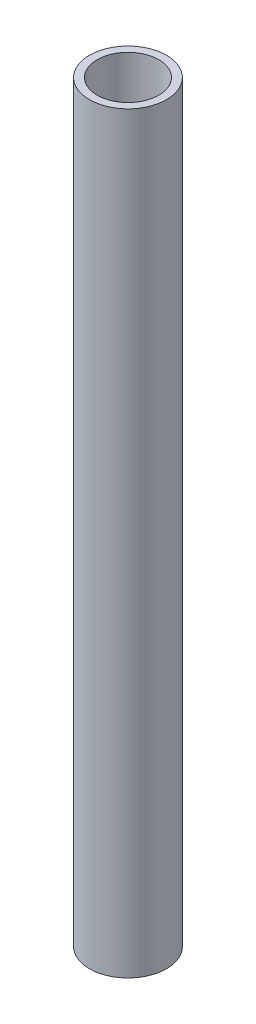
from build123d import *

# Parameters (mm, degrees)
SKETCH1_R           = 10
SKETCH1_R_2         = 8
BOSS_EXTRUDE1_DEPTH = 195.47145801


with BuildPart() as part:
    # Sketch1 → Boss-Extrude1 (new body)
    with BuildSketch(Plane(origin=(0, 0, 0), x_dir=(1, 0, 0), z_dir=(0, 1, 0))):
        Circle(SKETCH1_R)
        Circle(SKETCH1_R_2, mode=Mode.SUBTRACT)
    extrude(amount=BOSS_EXTRUDE1_DEPTH)


solid = part.part
